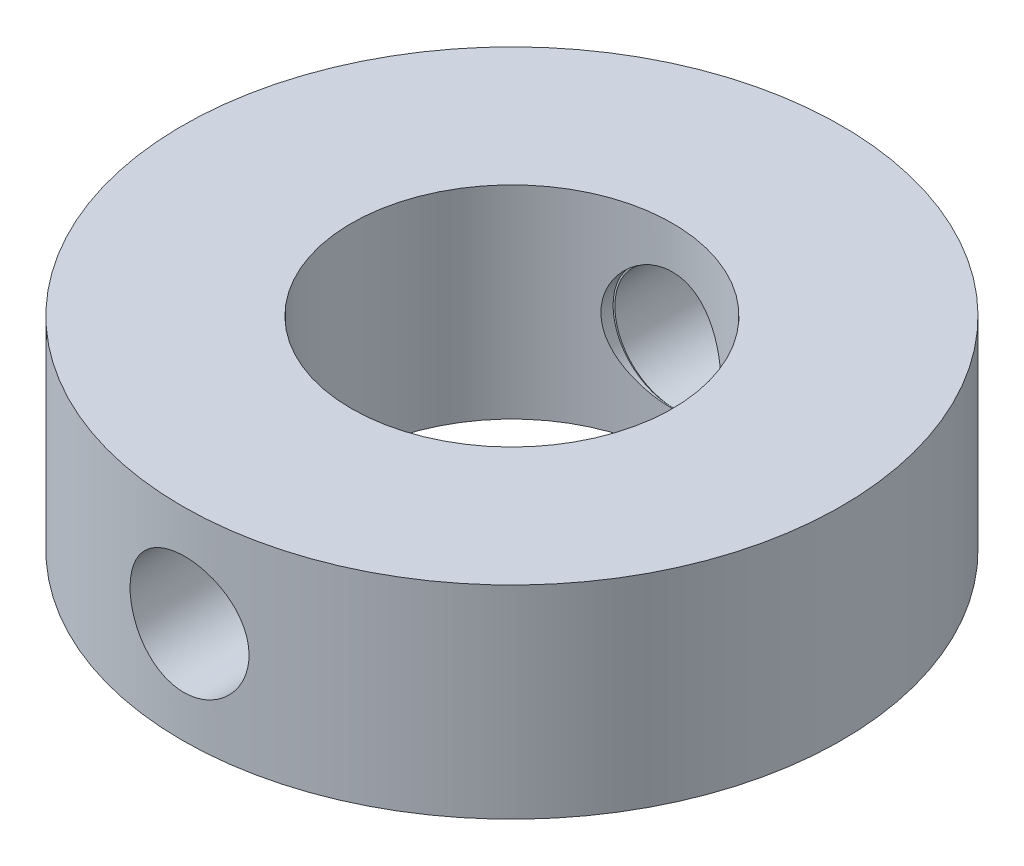
from build123d import *

# Parameters (mm, degrees)
BOSS_EXTRUDE1_DEPTH         = 1.5
BOSS_EXTRUDE1_DEPTH_BACK    = 1.5
HOLDER_RING_R               = 4.875
HOLDER_RING_R_2             = 2.375
M2X0_25_TAPPED_HOLE1_REACH  = 13.016
M2X0_25_TAPPED_HOLE1_BORE_R = 0.875
MIRROR1_START               = -2.389401654
MIRROR1_DEPTH               = 7.264401636


# Read off the part's stored shape, not the designer's step: Mirror1
with BuildPart() as part:
    # holder_ring → Boss-Extrude1 (new, two sides: drawn at the far end of the back side and taken through both)
    with BuildSketch(Plane(origin=(0, 0, 0), x_dir=(1, 0, 0), z_dir=(0, 1, 0)).offset(-BOSS_EXTRUDE1_DEPTH_BACK)):
        with Locations(Location((0, 0, 0), (0, 0, 270))):
            Circle(HOLDER_RING_R)
        with Locations(Location((0, 0, 0), (0, 0, 270))):
            Circle(HOLDER_RING_R_2, mode=Mode.SUBTRACT)
    extrude(amount=BOSS_EXTRUDE1_DEPTH + BOSS_EXTRUDE1_DEPTH_BACK)

    # M2x0.25 Tapped Hole1 bore (on position points) → M2x0.25 Tapped Hole1 (cut, up to next)
    with BuildSketch(Plane(origin=(0.02757507, 0.000556894, -4.874922011), x_dir=(-0.999984002302, 0, -0.005656424646), z_dir=(0.005656424646, 0, -0.999984002302)), mode=Mode.PRIVATE) as m2x0_25_tapped_hole1_sk1:
        Circle(M2X0_25_TAPPED_HOLE1_BORE_R)
    m2x0_25_tapped_hole1_tool1 = extrude(m2x0_25_tapped_hole1_sk1.sketch, amount=-M2X0_25_TAPPED_HOLE1_REACH, mode=Mode.PRIVATE) & part.part
    add(m2x0_25_tapped_hole1_tool1.solids().sort_by_distance((0.027575, 0.000557, -4.874922))[0], mode=Mode.SUBTRACT)

    # Mirror1 outline → Mirror1 (cut)
    with BuildSketch(Plane(origin=(0, 0, 0), x_dir=(0.99998400230215, 0, -0.00565642464579779), z_dir=(0.00565642464579779, 0, 0.99998400230215)).offset(MIRROR1_START)):
        with BuildLine():
            ThreePointArc((0.013515687, -0.874338715), (0.875, 0.000556894), (0.013515687, 0.875452503))
            ThreePointArc((0.013515687, 0.875452503), (-0.875, 0.000556894), (0.013515687, -0.874338715))
        make_face()
    extrude(amount=MIRROR1_DEPTH, mode=Mode.SUBTRACT)


solid = part.part
